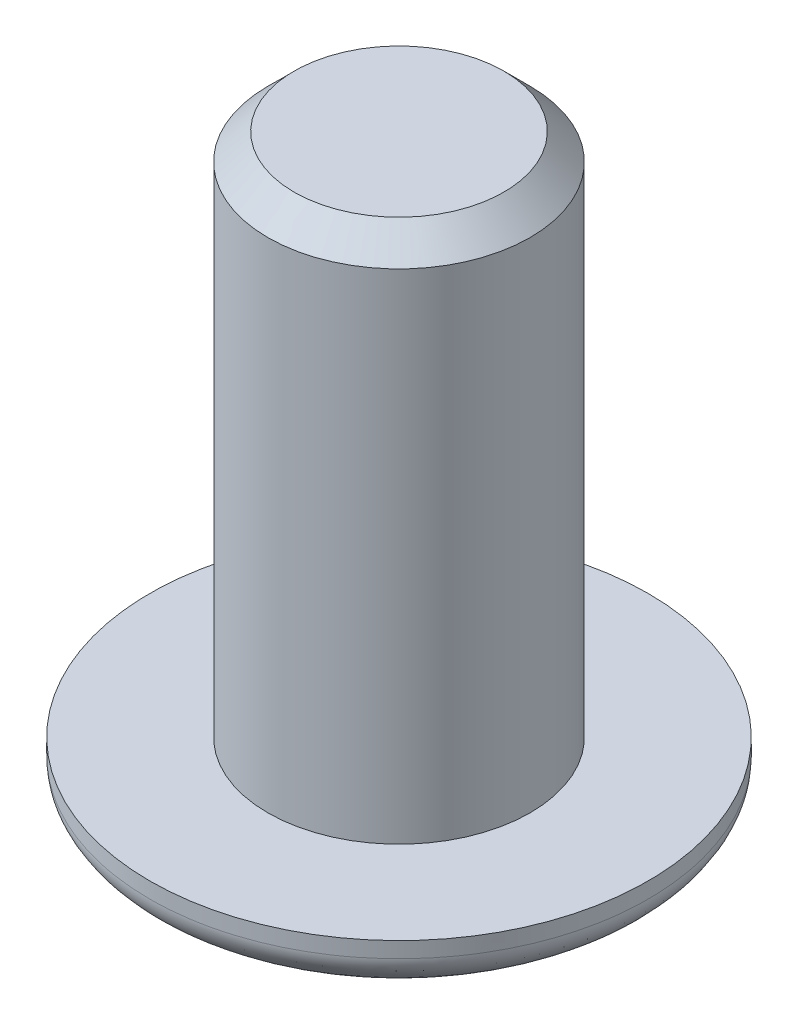
from build123d import *

# Parameters (mm, degrees)
SKETCH_1_R      = 4.75
EXTRUDE_1_DEPTH = 1.3
SKETCH_2_R      = 2.5
EXTRUDE_2_DEPTH = 10
CHAMFER_1_SIZE  = 0.5
FILLET_1_SIZE   = 1
FILLET_1_SIZE_2 = 2


with BuildPart() as part:
    # 草图1 → 凸台-拉伸1 (new body)
    with BuildSketch(Plane(origin=(0, 0, 0), x_dir=(1, 0, 0), z_dir=(0, 1, 0))):
        with Locations(Location((0, 0, 0), (0, 0, 270))):
            Circle(SKETCH_1_R)
        Polygon((0, -1.732050808), (1.5, -0.866025404), (1.5, 0.866025404), (0, 1.732050808), (-1.5, 0.866025404), (-1.5, -0.866025404), align=None, mode=Mode.SUBTRACT)
    extrude(amount=EXTRUDE_1_DEPTH)

    # 草图2 → 凸台-拉伸2 (add)
    with BuildSketch(Plane(origin=(0, 1.3, 0), x_dir=(1, 0, 0), z_dir=(0, 1, 0))):
        with Locations(Location((0, 0, 0), (0, 0, 270))):
            Circle(SKETCH_2_R)
    extrude(amount=EXTRUDE_2_DEPTH)

    # 倒角1
    chamfer_1_edges = [part.edges().sort_by_distance(p)[0] for p in [
        (0, 11.3, -2.5),
    ]]
    chamfer(chamfer_1_edges, length=CHAMFER_1_SIZE)

    # 圆角1
    # an asymmetric fillet: 2, 1 mm, written as the material it takes off along each edge
    with BuildSketch(Plane(origin=(0, 0, 0), x_dir=(0, 0, 1), z_dir=(-1, 0, 0))) as fillet_1_piece_1:
        with BuildLine():
            Bezier((4.75, FILLET_1_SIZE), (4.75, 0), (4.75 - FILLET_1_SIZE_2, 0), weights=[1, 0.707106781, 1])
            Line((4.75 - FILLET_1_SIZE_2, 0), (4.75, 0))
            Line((4.75, 0), (4.75, FILLET_1_SIZE))
        make_face()
    revolve(axis=Axis((0, 0, 0), (0, 1, 0)), mode=Mode.SUBTRACT)


solid = part.part
